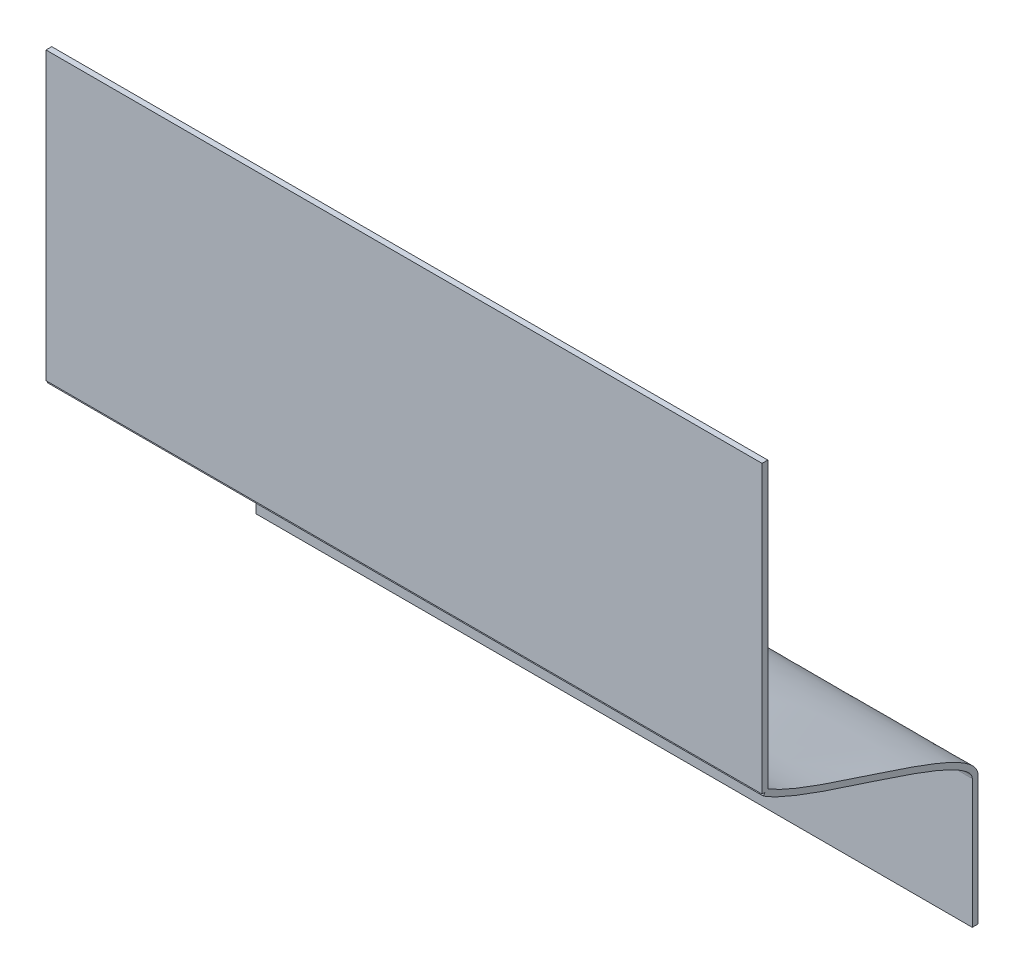
from build123d import *

# Parameters (mm, degrees)
SZKIC1_W                      = 25
SZKIC1_H                      = 4.5
DODANIE_WYCI_GNI_CIE1_DEPTH   = 0.2
SZKIC5_W                      = 25
SZKIC5_H                      = 10
DODANIE_WYCI_GNI_CIE2_DEPTH   = 0.2
WYCI_GNI_CIE_START            = -12.5
WYCI_GNI_CIE_PO_CIE_CE1_DEPTH = 25
SZKIC7_R                      = 0.5
WYTNIJ_WYCI_GNI_CIE1_DEPTH    = 0.1


# Read off the part's stored shape, not the designer's step: Wyciągnięcie po ścieżce1
with BuildPart() as part:
    # Szkic1 → Dodanie-wyciągnięcie1 (new body)
    with BuildSketch(Plane.XY):
        Rectangle(SZKIC1_W, SZKIC1_H)
    extrude(amount=-DODANIE_WYCI_GNI_CIE1_DEPTH)



with BuildPart() as body_2:
    # Szkic5 → Dodanie-wyciągnięcie2 (new body)
    with BuildSketch(Plane.XY.offset(7.14)):
        with Locations((0, 10.45)):
            Rectangle(SZKIC5_W, SZKIC5_H)
    extrude(amount=DODANIE_WYCI_GNI_CIE2_DEPTH)


with BuildPart() as part_1:
    add(part.part)

    add(body_2.part)  # Wyciągnięcie po ścieżce1 merges body 2
    # Wyciągnięcie po ścieżce1 outline → Wyciągnięcie po ścieżce1 (add)
    with BuildSketch(Plane.YZ.offset(WYCI_GNI_CIE_START)):
        with BuildLine():
            Line((2.25, 0), (2.25, -0.2))
            add(Edge.make_bspline(
                [(2.25, -0.2), (2.341119769, -0.1999999), (2.426780093, -0.167606025), (2.584094057, -0.062820109), (2.656970557, 0.009602947), (2.870167529, 0.275656686), (3.005566917, 0.519561466), (3.411079282, 1.394977099), (3.678048179, 2.170615411), (4.211959823, 3.795708962), (4.478490361, 4.644864189), (5.000012768, 6.107062113), (5.256319455, 6.728494593), (5.505761868, 7.14)],
                knots=[0, 0, 0, 0, 0.0625, 0.0625, 0.125, 0.125, 0.25, 0.25, 0.5, 0.5, 0.75, 0.75, 0.9907099, 0.9907099, 0.9907099, 0.9907099], degree=3))
            Line((5.505761868, 7.14), (5.45, 7.14))
            Line((5.45, 7.14), (5.45, 7.24))
            Line((5.45, 7.24), (5.365387844, 7.293298996))
            add(Edge.make_bspline(
                [(2.25, 0), (2.292213565, -5e-09), (2.339886574, 0.014821227), (2.449239276, 0.087660572), (2.50969611, 0.145647722), (2.696499138, 0.37876385), (2.827766417, 0.611558341), (3.222254052, 1.463173912), (3.488618487, 2.234801271), (4.02137351, 3.856374356), (4.288176188, 4.706620015), (4.823447241, 6.20736516), (5.091122437, 6.857902615), (5.365387844, 7.293298996)],
                knots=[0, 0, 0, 0, 0.0625, 0.0625, 0.125, 0.125, 0.25, 0.25, 0.5, 0.5, 0.75, 0.75, 1, 1, 1, 1], degree=3))
        make_face()
    extrude(amount=WYCI_GNI_CIE_PO_CIE_CE1_DEPTH)

    # Szkic7 → Wytnij-wyciągnięcie1 (cut)
    with BuildSketch(Plane(origin=(0, 0, 7.14), x_dir=(-1, 0, 0), z_dir=(0, 0, -1))):
        with Locations((-7.5, 12.95)):
            Circle(SZKIC7_R)
        with Locations(Location((-7.5, 7.95, 0), (0, 0, 180))):
            Circle(SZKIC7_R)
        with Locations((7.5, 7.95)):
            Circle(SZKIC7_R)
        with Locations(Location((7.5, 12.95, 0), (0, 0, 180))):
            Circle(SZKIC7_R)
        with Locations((0, 12.95)):
            Circle(SZKIC7_R)
        with Locations((0, 7.95)):
            Circle(SZKIC7_R)
    extrude(amount=-WYTNIJ_WYCI_GNI_CIE1_DEPTH, mode=Mode.SUBTRACT)


solid = part_1.part
